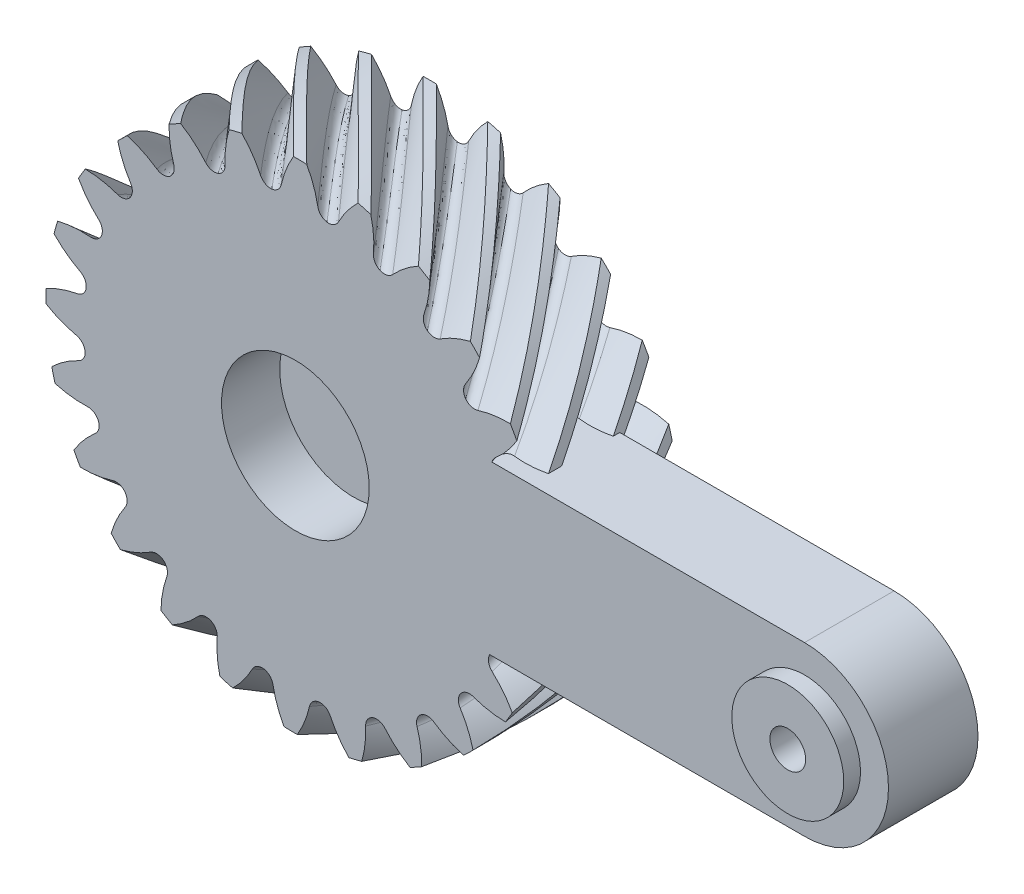
from build123d import *

# Parameters (mm, degrees)
CROQUIS1_R              = 22.285
SALIENTE_EXTRUIR1_DEPTH = 12
CORTAR_BARRER1_PITCH    = 138.9474165
MATRIZC1_COUNT          = 24
CROQUIS4_W              = 8
CROQUIS4_H              = 15
SALIENTE_EXTRUIR2_DEPTH = 38
CROQUIS7_W              = 8
CROQUIS7_H              = 15
SALIENTE_EXTRUIR3_DEPTH = 15
REDONDEO1_RADIUS        = 7.5
REDONDEO1_LENGTH        = 8
CROQUIS8_R              = 1.6
CORTAR_EXTRUIR2_DEPTH   = 59.048438753
CROQUIS9_R              = 6.6
CORTAR_EXTRUIR3_DEPTH   = 5.2
CORTAR_EXTRUIR4_START   = -5.2
CROQUIS10_R             = 6.6
CORTAR_EXTRUIR4_DEPTH   = 5.2
CROQUIS11_R             = 5
CROQUIS11_R_2           = 1.6
SALIENTE_EXTRUIR5_DEPTH = 1.5


with BuildPart() as part:
    # Croquis1 → Saliente-Extruir1 (new body)
    with BuildSketch(Plane.XY):
        Circle(CROQUIS1_R)
    extrude(amount=SALIENTE_EXTRUIR1_DEPTH)

    # Cortar-Barrer1: the profile of Croquis3 screwed along a left-hand helix of 0.086364 turns, 38 arcs to a turn; built about Z, then put on its axis
    cortar_barrer1_z = Axis((0, 0, 0), (0, 0, 1))
    cortar_barrer1_corners = [(22.277116139, -0.592723812, 0), (19.540167613, -1.630858567, 0), (18.748294913, -2.468259851, 0), (19.296449804, -3.482079114, 0), (21.671450025, -5.193214689, 0)]
    with BuildLine(mode=Mode.PRIVATE) as cortar_barrer1_profile:
        ThreePointArc((22.277116139, -0.592723812, 0), (20.951130897, -1.223809656, 0), (19.540167613, -1.630858567, 0))
        ThreePointArc((19.540167613, -1.630858567, 0), (19.011460123, -1.924006689, 0), (18.748294913, -2.468259851, 0))
        ThreePointArc((18.748294913, -2.468259851, 0), (18.861629902, -3.062080204, 0), (19.296449804, -3.482079114, 0))
        ThreePointArc((19.296449804, -3.482079114, 0), (20.55398367, -4.240442339, 0), (21.671450025, -5.193214689, 0))
        ThreePointArc((21.671450025, -5.193214689, 0), (22.094348736, -2.908776194, 0), (22.277116139, -0.592723812, 0))
    cortar_barrer1_cap = Face(cortar_barrer1_profile.wire())
    cortar_barrer1_arcs = [((22.277116139, -0.592723812, 0), (20.994193153, -1.337339404, 0), (19.540167613, -1.630858567, 0), (1, 0.9866882332996559, 1)), ((19.540167613, -1.630858567, 0), (18.849002497, -1.770381705, 0), (18.748294913, -2.468259851, 0), (1, 0.8172662842446967, 1)), ((18.748294913, -2.468259851, 0), (18.664946814, -3.168423416, 0), (19.296449804, -3.482079114, 0), (1, 0.8172662842446616, 1)), ((19.296449804, -3.482079114, 0), (20.624962276, -4.141926355, 0), (21.671450025, -5.193214689, 0), (1, 0.9866882332996564, 1)), ((21.671450025, -5.193214689, 0), (22.215070418, -2.924669505, 0), (22.277116139, -0.592723812, 0), (1, 0.9945657753971829, 1))]  # start, shoulder, end, weights
    cortar_barrer1_turn_angles = [0, -4.736842105, -9.473684211, -14.210526316, -18.947368421, -23.684210526, -28.421052632, -29.755975482, -31.090898333]
    cortar_barrer1_turn_weights = [1, 0.9965844930066698, 1, 0.9965844930066698, 1, 0.9965844930066698, 1, 0.9997285952601567, 1]
    cortar_barrer1_turn_sides = [Face.make_bezier_surface([[Vector(p[j][0], p[j][1], 0).rotate(cortar_barrer1_z, cortar_barrer1_turn_angles[2 * i + k]) / cortar_barrer1_turn_weights[2 * i + k] + Vector(0, 0, p[j][2] + -CORTAR_BARRER1_PITCH * cortar_barrer1_turn_angles[2 * i + k] / 360) for k in range(3)] for j in range(3)], [[p[3][j] * cortar_barrer1_turn_weights[2 * i + k] for k in range(3)] for j in range(3)]) for p in cortar_barrer1_arcs for i in range(4)]
    cortar_barrer1 = Plane(origin=(0, 0, 0), x_dir=(0, 1, 0), z_dir=(0, 0, 1)) * Solid(Shell([*cortar_barrer1_turn_sides, cortar_barrer1_cap, cortar_barrer1_cap.rotate(cortar_barrer1_z, -31.090898333).moved(Location((0, 0, -CORTAR_BARRER1_PITCH * -31.090898333 / 360)))]))
    add(cortar_barrer1, mode=Mode.SUBTRACT)

    # MatrizC1: Cortar-Barrer1 ×24 about axis
    matrizc1_axis = Axis((0, 0, 0), (0, 0, -1))
    for i in range(1, MATRIZC1_COUNT):
        add(cortar_barrer1.rotate(matrizc1_axis, i * 360 / MATRIZC1_COUNT), mode=Mode.SUBTRACT)

    # Croquis4 → Saliente-Extruir2 (add)
    with BuildSketch(Plane(origin=(0, 0, 0), x_dir=(0, 0, -1), z_dir=(1, 0, 0))):
        with Locations((-8, 0)):
            Rectangle(CROQUIS4_W, CROQUIS4_H)
    extrude(amount=SALIENTE_EXTRUIR2_DEPTH)

    # Croquis7 → Saliente-Extruir3 (add)
    with BuildSketch(Plane(origin=(38, 0, 0), x_dir=(0, 0, -1), z_dir=(1, 0, 0))):
        with Locations((-8, 0)):
            Rectangle(CROQUIS7_W, CROQUIS7_H)
    extrude(amount=SALIENTE_EXTRUIR3_DEPTH)

    # Redondeo1: full round fillet: the end face becomes a half cylinder, R = half its width
    redondeo1_face = Plane((53, 0, 8), x_dir=(0, 0, -1), z_dir=(1, 0, 0))  # on the end face: x along it, z out of the body
    redondeo1_slab = redondeo1_face.offset(-REDONDEO1_RADIUS / 2) * Box(REDONDEO1_LENGTH, 2 * REDONDEO1_RADIUS, REDONDEO1_RADIUS, mode=Mode.PRIVATE)  # the body's end, R deep
    redondeo1_round = Plane((45.5, 0, 8), x_dir=(1, 0, 0), z_dir=(0, 0, -1)) * Cylinder(REDONDEO1_RADIUS, REDONDEO1_LENGTH, mode=Mode.PRIVATE)  # its axis R under the face
    add(redondeo1_slab - redondeo1_round, mode=Mode.SUBTRACT)

    # Croquis8 → Cortar-Extruir2 (cut, through all)
    with BuildSketch(Plane(origin=(0, 0, 4), x_dir=(-1, 0, 0), z_dir=(0, 0, -1))):
        with Locations((-45.5, 0)):
            Circle(CROQUIS8_R)
    extrude(amount=-CORTAR_EXTRUIR2_DEPTH, mode=Mode.SUBTRACT)

    # Croquis9 → Cortar-Extruir3 (cut)
    with BuildSketch(Plane(origin=(0, 0, 0), x_dir=(-1, 0, 0), z_dir=(0, 0, -1))):
        Circle(CROQUIS9_R)
    extrude(amount=-CORTAR_EXTRUIR3_DEPTH, mode=Mode.SUBTRACT)

    # Croquis10 → Cortar-Extruir4 (cut)
    with BuildSketch(Plane.XY.offset(12).offset(CORTAR_EXTRUIR4_START)):
        with Locations(Location((0, 0, 0), (0, 0, 180))):
            Circle(CROQUIS10_R)
    extrude(amount=CORTAR_EXTRUIR4_DEPTH, mode=Mode.SUBTRACT)

    # Croquis11 → Saliente-Extruir5 (add)
    with BuildSketch(Plane(origin=(0, 0, 12), x_dir=(-1, 0, 0), z_dir=(0, 0, -1))):
        with Locations(Location((-45.5, 0, 0), (0, 0, 180))):
            Circle(CROQUIS11_R)
        with Locations((-45.5, 0)):
            Circle(CROQUIS11_R_2, mode=Mode.SUBTRACT)
    extrude(amount=-SALIENTE_EXTRUIR5_DEPTH)


solid = part.part
